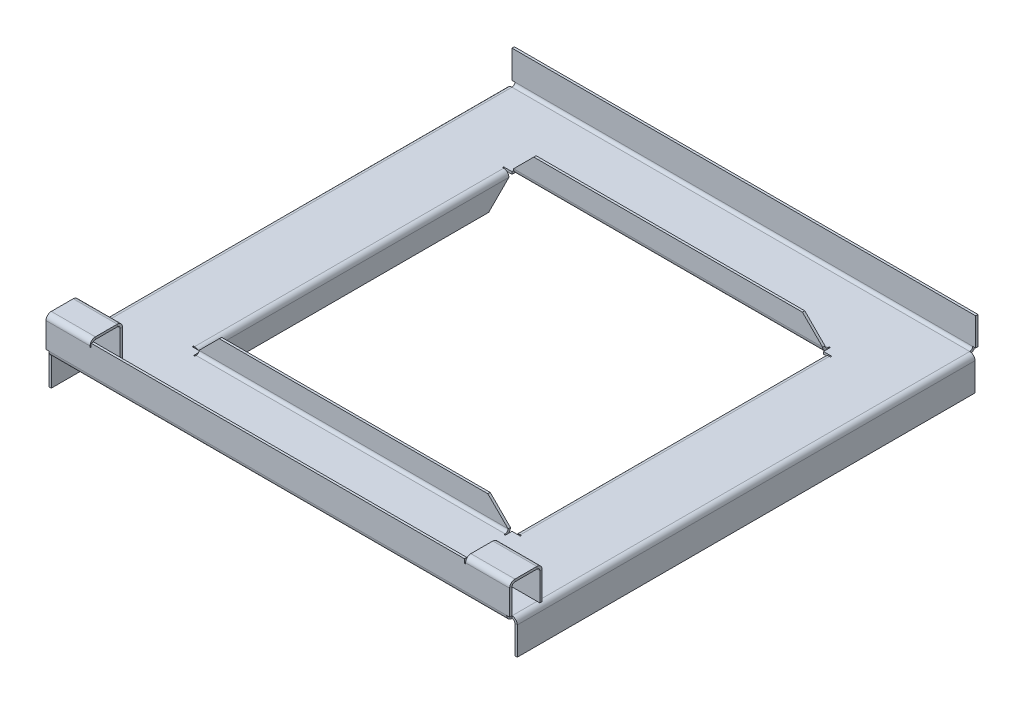
from build123d import *

# Parameters (mm, degrees)
SKETCH1_W                       = 300
SKETCH1_H                       = 300
SKETCH1_W_2                     = 200
SKETCH1_H_2                     = 200
BASE_FLANGE1_DEPTH              = 1.51892
EDGE_FLANGE10_STRIP_W           = 9.88568
EDGE_FLANGE10_STRIP_H           = 1.51892
EDGE_FLANGE10_STRIP_CUT_DEPTH   = 300
EDGE_FLANGE10_STRIP_2_W         = 9.88568
EDGE_FLANGE10_STRIP_2_H         = 1.51892
EDGE_FLANGE10_STRIP_CUT_2_DEPTH = 300
EDGE_FLANGE10_DEPTH             = 300
EDGE_FLANGE10_BEND_DEPTH        = 300
EDGE_FLANGE2_START              = -151.51892
EDGE_FLANGE2_DEPTH              = 303.03784
EDGE_FLANGE2_2_DEPTH            = 3.42392
EDGE_FLANGE2_START_2            = 148.095
EDGE_FLANGE2_3_DEPTH            = 3.42392
EDGE_FLANGE2_START_3            = -148.095
EDGE_FLANGE2_4_DEPTH            = 296.19
EDGE_FLANGE7_START              = -100.75946
EDGE_FLANGE7_DEPTH              = 201.51892
EDGE_FLANGE7_2_DEPTH            = 0.75946
EDGE_FLANGE7_START_2            = 100
EDGE_FLANGE7_3_DEPTH            = 0.75946
EDGE_FLANGE7_START_3            = -100
EDGE_FLANGE7_4_DEPTH            = 200
EDGE_FLANGE8_STRIP_W            = 11.88568
EDGE_FLANGE8_STRIP_H            = 1.51892
EDGE_FLANGE8_STRIP_CUT_DEPTH    = 200
EDGE_FLANGE8_RELIEF_W           = 12.64514
EDGE_FLANGE8_RELIEF_H           = 0.75946
EDGE_FLANGE8_RELIEF_CUT_DEPTH   = 1.51892
EDGE_FLANGE8_STRIP_2_W          = 11.88568
EDGE_FLANGE8_STRIP_2_H          = 1.51892
EDGE_FLANGE8_STRIP_CUT_2_DEPTH  = 200
EDGE_FLANGE8_RELIEF_2_W         = 12.64514
EDGE_FLANGE8_RELIEF_2_H         = 0.75946
EDGE_FLANGE8_RELIEF_CUT_2_DEPTH = 1.51892
EDGE_FLANGE8_DEPTH              = 200
EDGE_FLANGE8_BEND_DEPTH         = 200
BREAK_CORNER1_START             = -82.391318469
BREAK_CORNER1_OUTLINE_W         = 22
BREAK_CORNER1_OUTLINE_H         = 208
BREAK_CORNER1_DEPTH             = 9.258856193
BREAK_CORNER1_START_2           = 73.132462276
BREAK_CORNER1_2_OUTLINE_W       = 22
BREAK_CORNER1_2_OUTLINE_H       = 208
BREAK_CORNER1_2_DEPTH           = 9.258856193
BREAK_CORNER1_START_3           = -81.317279836
BREAK_CORNER1_3_OUTLINE_W       = 210
BREAK_CORNER1_3_OUTLINE_H       = 22
BREAK_CORNER1_3_DEPTH           = 9.258856192
BREAK_CORNER1_4_OUTLINE_W       = 210
BREAK_CORNER1_4_OUTLINE_H       = 22
BREAK_CORNER1_4_DEPTH           = 9.258856192
EDGE_FLANGE11_STRIP_W           = 9.88568
EDGE_FLANGE11_STRIP_H           = 1.51892
EDGE_FLANGE11_STRIP_CUT_DEPTH   = 28.504683669
EDGE_FLANGE11_RELIEF_W          = 10.64514
EDGE_FLANGE11_RELIEF_H          = 0.75946
EDGE_FLANGE11_RELIEF_CUT_DEPTH  = 1.51892
EDGE_FLANGE11_DEPTH             = 28.504683669
EDGE_FLANGE12_STRIP_W           = 9.88568
EDGE_FLANGE12_STRIP_H           = 1.51892
EDGE_FLANGE12_STRIP_CUT_DEPTH   = 28.504683669
EDGE_FLANGE12_DEPTH             = 28.504683669


# Read off the part's stored shape, not the designer's step: Edge-Flange2, Edge-Flange7, Break-Corner1
# Sheet-metal steps are written as plain solids
with BuildPart() as part:
    # Sketch1 → Base-Flange1 (new body)
    with BuildSketch(Plane(origin=(0, 0, 0), x_dir=(1, 0, 0), z_dir=(0, 1, 0))):
        Rectangle(SKETCH1_W, SKETCH1_H)
        Rectangle(SKETCH1_W_2, SKETCH1_H_2, mode=Mode.SUBTRACT)
    extrude(amount=BASE_FLANGE1_DEPTH)

    # Edge-Flange10 strip (across the edge) → Edge-Flange10 strip cut (cut)
    with BuildSketch(Plane(origin=(150, 1.51892, -150), x_dir=(0, 0, 1), z_dir=(-1, 0, 0))):
        with Locations((-3.03784, -0.75946)):
            Rectangle(EDGE_FLANGE10_STRIP_W, EDGE_FLANGE10_STRIP_H)
    extrude(amount=EDGE_FLANGE10_STRIP_CUT_DEPTH, mode=Mode.SUBTRACT)

    # Edge-Flange10 strip 2 (across the edge) → Edge-Flange10 strip cut 2 (cut)
    with BuildSketch(Plane(origin=(-150, 1.51892, 150), x_dir=(0, 0, -1), z_dir=(1, 0, 0))):
        with Locations((-3.03784, -0.75946)):
            Rectangle(EDGE_FLANGE10_STRIP_2_W, EDGE_FLANGE10_STRIP_2_H)
    extrude(amount=EDGE_FLANGE10_STRIP_CUT_2_DEPTH, mode=Mode.SUBTRACT)

    # Edge-Flange10 section (across the edge) → Edge-Flange10 (add)
    with BuildSketch(Plane(origin=(150, 1.51892, -150), x_dir=(0, 0, 1), z_dir=(-1, 0, 0))):
        with BuildLine():
            Line((-1.51892, 1.905), (-1.51892, 20))
            Line((-1.51892, 20), (0, 20))
            Line((0, 20), (0, 1.905))
            ThreePointArc((0, 1.905), (0.557961582, 0.557961582), (1.905, 0))
            Line((1.905, 0), (1.905, -1.51892))
            ThreePointArc((1.905, -1.51892), (-0.51607705, -0.51607705), (-1.51892, 1.905))
        make_face()
    extrude(amount=EDGE_FLANGE10_DEPTH)

    # Edge-Flange10 section 2 (across the edge) → Edge-Flange10 bend (add)
    with BuildSketch(Plane(origin=(-150, 1.51892, 150), x_dir=(0, 0, -1), z_dir=(1, 0, 0))):
        with BuildLine():
            Line((-1.51892, 1.905), (-1.51892, 20))
            Line((-1.51892, 20), (0, 20))
            Line((0, 20), (0, 1.905))
            ThreePointArc((0, 1.905), (0.557961582, 0.557961582), (1.905, 0))
            Line((1.905, 0), (1.905, -1.51892))
            ThreePointArc((1.905, -1.51892), (-0.51607705, -0.51607705), (-1.51892, 1.905))
        make_face()
    extrude(amount=EDGE_FLANGE10_BEND_DEPTH)

    # Edge-Flange2 outline → Edge-Flange2 (cut)
    with BuildSketch(Plane.XY.offset(EDGE_FLANGE2_START)):
        with BuildLine():
            Line((-148.095, 1.51892), (-148.095, 3.42392))
            Line((-148.095, 3.42392), (-150, 3.42392))
            Line((-150, 3.42392), (-150, 0.940031312))
            ThreePointArc((-150, 0.940031312), (-149.090507046, 1.37100273), (-148.095, 1.51892))
        make_face()
        with BuildLine():
            Line((150, 0.940031312), (150, 3.42392))
            Line((150, 3.42392), (148.095, 3.42392))
            Line((148.095, 3.42392), (148.095, 1.51892))
            ThreePointArc((148.095, 1.51892), (149.090507046, 1.37100273), (150, 0.940031312))
        make_face()
    extrude(amount=EDGE_FLANGE2_DEPTH, mode=Mode.SUBTRACT)

    # Edge-Flange2 2 outline → Edge-Flange2 2 (cut)
    with BuildSketch(Plane.XY.offset(EDGE_FLANGE2_START)):
        with BuildLine():
            Line((-148.095, 0), (-148.095, 1.51892))
            ThreePointArc((-148.095, 1.51892), (-149.090507046, 1.37100273), (-150, 0.940031312))
            ThreePointArc((-150, 0.940031312), (-151.115413528, -0.292446037), (-151.51892, -1.905))
            Line((-151.51892, -1.905), (-151.51892, -20))
            Line((-151.51892, -20), (-150, -20))
            Line((-150, -20), (-150, -1.905))
            ThreePointArc((-150, -1.905), (-149.442038418, -0.557961582), (-148.095, 0))
        make_face()
        with BuildLine():
            ThreePointArc((150, 0.940031312), (149.090507046, 1.37100273), (148.095, 1.51892))
            Line((148.095, 1.51892), (148.095, 0))
            ThreePointArc((148.095, 0), (149.442038418, -0.557961582), (150, -1.905))
            Line((150, -1.905), (150, -20))
            Line((150, -20), (151.51892, -20))
            Line((151.51892, -20), (151.51892, -1.905))
            ThreePointArc((151.51892, -1.905), (151.115413528, -0.292446037), (150, 0.940031312))
        make_face()
    extrude(amount=EDGE_FLANGE2_2_DEPTH, mode=Mode.SUBTRACT)

    # Edge-Flange2 3 outline → Edge-Flange2 3 (cut)
    with BuildSketch(Plane.XY.offset(EDGE_FLANGE2_START_2)):
        with BuildLine():
            Line((-148.095, 0), (-148.095, 1.51892))
            ThreePointArc((-148.095, 1.51892), (-149.090507046, 1.37100273), (-150, 0.940031312))
            ThreePointArc((-150, 0.940031312), (-151.115413528, -0.292446037), (-151.51892, -1.905))
            Line((-151.51892, -1.905), (-151.51892, -20))
            Line((-151.51892, -20), (-150, -20))
            Line((-150, -20), (-150, -1.905))
            ThreePointArc((-150, -1.905), (-149.442038418, -0.557961582), (-148.095, 0))
        make_face()
        with BuildLine():
            ThreePointArc((150, 0.940031312), (149.090507046, 1.37100273), (148.095, 1.51892))
            Line((148.095, 1.51892), (148.095, 0))
            ThreePointArc((148.095, 0), (149.442038418, -0.557961582), (150, -1.905))
            Line((150, -1.905), (150, -20))
            Line((150, -20), (151.51892, -20))
            Line((151.51892, -20), (151.51892, -1.905))
            ThreePointArc((151.51892, -1.905), (151.115413528, -0.292446037), (150, 0.940031312))
        make_face()
    extrude(amount=EDGE_FLANGE2_3_DEPTH, mode=Mode.SUBTRACT)

    # Edge-Flange2 4 outline → Edge-Flange2 4 (add)
    with BuildSketch(Plane.XY.offset(EDGE_FLANGE2_START_3)):
        with BuildLine():
            Line((-148.095, 0), (-148.095, 1.51892))
            ThreePointArc((-148.095, 1.51892), (-149.090507046, 1.37100273), (-150, 0.940031312))
            ThreePointArc((-150, 0.940031312), (-151.115413528, -0.292446037), (-151.51892, -1.905))
            Line((-151.51892, -1.905), (-151.51892, -20))
            Line((-151.51892, -20), (-150, -20))
            Line((-150, -20), (-150, -1.905))
            ThreePointArc((-150, -1.905), (-149.442038418, -0.557961582), (-148.095, 0))
        make_face()
        with BuildLine():
            ThreePointArc((150, 0.940031312), (149.090507046, 1.37100273), (148.095, 1.51892))
            Line((148.095, 1.51892), (148.095, 0))
            ThreePointArc((148.095, 0), (149.442038418, -0.557961582), (150, -1.905))
            Line((150, -1.905), (150, -20))
            Line((150, -20), (151.51892, -20))
            Line((151.51892, -20), (151.51892, -1.905))
            ThreePointArc((151.51892, -1.905), (151.115413528, -0.292446037), (150, 0.940031312))
        make_face()
    extrude(amount=EDGE_FLANGE2_4_DEPTH)

    # Edge-Flange7 outline → Edge-Flange7 (cut)
    with BuildSketch(Plane.YZ.offset(EDGE_FLANGE7_START)):
        with BuildLine():
            ThreePointArc((1.51892, 101.578888688), (0.403506472, 102.811366037), (0, 104.42392))
            Line((0, 104.42392), (0, 100))
            Line((0, 100), (1.51892, 100))
            Line((1.51892, 100), (1.51892, 101.578888688))
        make_face()
        with BuildLine():
            Line((1.51892, -100), (0, -100))
            Line((0, -100), (0, -104.42392))
            ThreePointArc((0, -104.42392), (0.403506472, -102.811366037), (1.51892, -101.578888688))
            Line((1.51892, -101.578888688), (1.51892, -100))
        make_face()
    extrude(amount=EDGE_FLANGE7_DEPTH, mode=Mode.SUBTRACT)

    # Edge-Flange7 2 outline → Edge-Flange7 2 (cut)
    with BuildSketch(Plane.YZ.offset(EDGE_FLANGE7_START)):
        with BuildLine():
            Line((1.51892, 105.18338), (0, 105.18338))
            Line((0, 105.18338), (0, 104.42392))
            ThreePointArc((0, 104.42392), (0.403506472, 102.811366037), (1.51892, 101.578888688))
            Line((1.51892, 101.578888688), (1.51892, 105.18338))
        make_face()
        with BuildLine():
            ThreePointArc((1.51892, -101.578888688), (0.403506472, -102.811366037), (0, -104.42392))
            Line((0, -104.42392), (0, -105.18338))
            Line((0, -105.18338), (1.51892, -105.18338))
            Line((1.51892, -105.18338), (1.51892, -101.578888688))
        make_face()
    extrude(amount=EDGE_FLANGE7_2_DEPTH, mode=Mode.SUBTRACT)

    # Edge-Flange7 3 outline → Edge-Flange7 3 (cut)
    with BuildSketch(Plane.YZ.offset(EDGE_FLANGE7_START_2)):
        with BuildLine():
            Line((1.51892, 105.18338), (0, 105.18338))
            Line((0, 105.18338), (0, 104.42392))
            ThreePointArc((0, 104.42392), (0.403506472, 102.811366037), (1.51892, 101.578888688))
            Line((1.51892, 101.578888688), (1.51892, 105.18338))
        make_face()
        with BuildLine():
            ThreePointArc((1.51892, -101.578888688), (0.403506472, -102.811366037), (0, -104.42392))
            Line((0, -104.42392), (0, -105.18338))
            Line((0, -105.18338), (1.51892, -105.18338))
            Line((1.51892, -105.18338), (1.51892, -101.578888688))
        make_face()
    extrude(amount=EDGE_FLANGE7_3_DEPTH, mode=Mode.SUBTRACT)

    # Edge-Flange7 4 outline → Edge-Flange7 4 (add)
    with BuildSketch(Plane.YZ.offset(EDGE_FLANGE7_START_3)):
        with BuildLine():
            ThreePointArc((3.42392, 102.51892), (2.076881582, 103.076881582), (1.51892, 104.42392))
            Line((1.51892, 104.42392), (1.51892, 101.578888688))
            ThreePointArc((1.51892, 101.578888688), (2.428412954, 101.14791727), (3.42392, 101))
            Line((3.42392, 101), (16.51892, 101))
            Line((16.51892, 101), (16.51892, 102.51892))
            Line((16.51892, 102.51892), (3.42392, 102.51892))
        make_face()
        with BuildLine():
            ThreePointArc((3.42392, -101), (2.428412954, -101.14791727), (1.51892, -101.578888688))
            Line((1.51892, -101.578888688), (1.51892, -104.42392))
            ThreePointArc((1.51892, -104.42392), (2.076881582, -103.076881582), (3.42392, -102.51892))
            Line((3.42392, -102.51892), (16.51892, -102.51892))
            Line((16.51892, -102.51892), (16.51892, -101))
            Line((16.51892, -101), (3.42392, -101))
        make_face()
    extrude(amount=EDGE_FLANGE7_4_DEPTH)

    # Edge-Flange8 strip (across the edge) → Edge-Flange8 strip cut (cut)
    with BuildSketch(Plane(origin=(102, 0, 100), x_dir=(1, 0, 0), z_dir=(0, 0, -1))):
        with Locations((-2.51892, -0.75946)):
            Rectangle(EDGE_FLANGE8_STRIP_W, EDGE_FLANGE8_STRIP_H)
    extrude(amount=EDGE_FLANGE8_STRIP_CUT_DEPTH, mode=Mode.SUBTRACT)

    # Edge-Flange8 relief (on the sheet) → Edge-Flange8 relief cut (cut)
    with BuildSketch(Plane(origin=(105.42392, 0, 100), x_dir=(1, 0, 0), z_dir=(0, -1, 0))):
        with Locations((-5.56311, 0.37973)):
            Rectangle(EDGE_FLANGE8_RELIEF_W, EDGE_FLANGE8_RELIEF_H)
        with Locations((-5.56311, -200.37973)):
            Rectangle(EDGE_FLANGE8_RELIEF_W, EDGE_FLANGE8_RELIEF_H)
    extrude(amount=-EDGE_FLANGE8_RELIEF_CUT_DEPTH, mode=Mode.SUBTRACT)

    # Edge-Flange8 strip 2 (across the edge) → Edge-Flange8 strip cut 2 (cut)
    with BuildSketch(Plane(origin=(-102, 0, -100), x_dir=(-1, 0, 0), z_dir=(0, 0, 1))):
        with Locations((-2.51892, -0.75946)):
            Rectangle(EDGE_FLANGE8_STRIP_2_W, EDGE_FLANGE8_STRIP_2_H)
    extrude(amount=EDGE_FLANGE8_STRIP_CUT_2_DEPTH, mode=Mode.SUBTRACT)

    # Edge-Flange8 relief 2 (on the sheet) → Edge-Flange8 relief cut 2 (cut)
    with BuildSketch(Plane(origin=(-105.42392, 0, -100), x_dir=(-1, 0, 0), z_dir=(0, -1, 0))):
        with Locations((-5.56311, 0.37973)):
            Rectangle(EDGE_FLANGE8_RELIEF_2_W, EDGE_FLANGE8_RELIEF_2_H)
        with Locations((-5.56311, -200.37973)):
            Rectangle(EDGE_FLANGE8_RELIEF_2_W, EDGE_FLANGE8_RELIEF_2_H)
    extrude(amount=-EDGE_FLANGE8_RELIEF_CUT_2_DEPTH, mode=Mode.SUBTRACT)

    # Edge-Flange8 section (across the edge) → Edge-Flange8 (add)
    with BuildSketch(Plane(origin=(102, 0, 100), x_dir=(1, 0, 0), z_dir=(0, 0, -1))):
        with BuildLine():
            Line((0, 1.905), (0, 15))
            Line((0, 15), (1.51892, 15))
            Line((1.51892, 15), (1.51892, 1.905))
            ThreePointArc((1.51892, 1.905), (2.076881582, 0.557961582), (3.42392, 0))
            Line((3.42392, 0), (3.42392, -1.51892))
            ThreePointArc((3.42392, -1.51892), (1.00284295, -0.51607705), (0, 1.905))
        make_face()
    extrude(amount=EDGE_FLANGE8_DEPTH)

    # Edge-Flange8 section 2 (across the edge) → Edge-Flange8 bend (add)
    with BuildSketch(Plane(origin=(-102, 0, -100), x_dir=(-1, 0, 0), z_dir=(0, 0, 1))):
        with BuildLine():
            Line((0, 1.905), (0, 15))
            Line((0, 15), (1.51892, 15))
            Line((1.51892, 15), (1.51892, 1.905))
            ThreePointArc((1.51892, 1.905), (2.076881582, 0.557961582), (3.42392, 0))
            Line((3.42392, 0), (3.42392, -1.51892))
            ThreePointArc((3.42392, -1.51892), (1.00284295, -0.51607705), (0, 1.905))
        make_face()
    extrude(amount=EDGE_FLANGE8_BEND_DEPTH)

    # Break-Corner1 outline → Break-Corner1 (cut)
    with BuildSketch(Plane(origin=(0, 0, 0), x_dir=(0.7071067811865471, 0.707106781186548, 0), z_dir=(0.707106781186548, -0.707106781186547, 0)).offset(BREAK_CORNER1_START)):
        with Locations((-59, 0)):
            Rectangle(BREAK_CORNER1_OUTLINE_W, BREAK_CORNER1_OUTLINE_H)
    extrude(amount=BREAK_CORNER1_DEPTH, mode=Mode.SUBTRACT)

    # Break-Corner1 2 outline → Break-Corner1 2 (cut)
    with BuildSketch(Plane(origin=(0, 0, 0), x_dir=(0.7071067811865471, -0.707106781186548, 0), z_dir=(0.707106781186548, 0.707106781186547, 0)).offset(BREAK_CORNER1_START_2)):
        with Locations((59, 0)):
            Rectangle(BREAK_CORNER1_2_OUTLINE_W, BREAK_CORNER1_2_OUTLINE_H)
    extrude(amount=BREAK_CORNER1_2_DEPTH, mode=Mode.SUBTRACT)

    # Break-Corner1 3 outline → Break-Corner1 3 (cut)
    with BuildSketch(Plane(origin=(0, 0, 0), x_dir=(1, 0, 0), z_dir=(0, 0.707106781186549, -0.707106781186546)).offset(BREAK_CORNER1_START_3)):
        with Locations((0, -60)):
            Rectangle(BREAK_CORNER1_3_OUTLINE_W, BREAK_CORNER1_3_OUTLINE_H)
    extrude(amount=BREAK_CORNER1_3_DEPTH, mode=Mode.SUBTRACT)

    # Break-Corner1 4 outline → Break-Corner1 4 (cut)
    with BuildSketch(Plane(origin=(0, 0, 0), x_dir=(1, 0, 0), z_dir=(0, 0.707106781186547, 0.707106781186548)).offset(BREAK_CORNER1_START_3)):
        with Locations((0, 60)):
            Rectangle(BREAK_CORNER1_4_OUTLINE_W, BREAK_CORNER1_4_OUTLINE_H)
    extrude(amount=BREAK_CORNER1_4_DEPTH, mode=Mode.SUBTRACT)

    # Edge-Flange11 strip (across the edge) → Edge-Flange11 strip cut (cut)
    with BuildSketch(Plane(origin=(-150, 21.51892, 150), x_dir=(0, -1, 0), z_dir=(1, 0, 0))):
        with Locations((-3.03784, -0.75946)):
            Rectangle(EDGE_FLANGE11_STRIP_W, EDGE_FLANGE11_STRIP_H)
    edge_flange11_strip_cut = extrude(amount=EDGE_FLANGE11_STRIP_CUT_DEPTH, mode=Mode.SUBTRACT)

    # Edge-Flange11 relief (on the sheet) → Edge-Flange11 relief cut (cut)
    with BuildSketch(Plane(origin=(-150, 19.61392, 150), x_dir=(0, -1, 0), z_dir=(0, 0, -1))):
        with Locations((-4.56311, -28.884413669)):
            Rectangle(EDGE_FLANGE11_RELIEF_W, EDGE_FLANGE11_RELIEF_H)
    edge_flange11_relief_cut = extrude(amount=-EDGE_FLANGE11_RELIEF_CUT_DEPTH, mode=Mode.SUBTRACT)

    # Edge-Flange11 section (across the edge) → Edge-Flange11 (add)
    with BuildSketch(Plane(origin=(-150, 21.51892, 150), x_dir=(0, -1, 0), z_dir=(1, 0, 0))):
        with BuildLine():
            Line((-1.51892, 1.905), (-1.51892, 18))
            Line((-1.51892, 18), (0, 18))
            Line((0, 18), (0, 1.905))
            ThreePointArc((0, 1.905), (0.557961582, 0.557961582), (1.905, 0))
            Line((1.905, 0), (1.905, -1.51892))
            ThreePointArc((1.905, -1.51892), (-0.51607705, -0.51607705), (-1.51892, 1.905))
        make_face()
    edge_flange11 = extrude(amount=EDGE_FLANGE11_DEPTH)

    # Edge-Flange12 strip (across the edge) → Edge-Flange12 strip cut (cut)
    with BuildSketch(Plane(origin=(-150, 21.51892, 132), x_dir=(0, 0, 1), z_dir=(1, 0, 0))):
        with Locations((-3.03784, -0.75946)):
            Rectangle(EDGE_FLANGE12_STRIP_W, EDGE_FLANGE12_STRIP_H)
    edge_flange12_strip_cut = extrude(amount=EDGE_FLANGE12_STRIP_CUT_DEPTH, mode=Mode.SUBTRACT)

    # Edge-Flange12 section (across the edge) → Edge-Flange12 (add)
    with BuildSketch(Plane(origin=(-150, 21.51892, 132), x_dir=(0, 0, 1), z_dir=(1, 0, 0))):
        with BuildLine():
            Line((-1.51892, 1.905), (-1.51892, 19.9))
            Line((-1.51892, 19.9), (0, 19.9))
            Line((0, 19.9), (0, 1.905))
            ThreePointArc((0, 1.905), (0.557961582, 0.557961582), (1.905, 0))
            Line((1.905, 0), (1.905, -1.51892))
            ThreePointArc((1.905, -1.51892), (-0.51607705, -0.51607705), (-1.51892, 1.905))
        make_face()
    edge_flange12 = extrude(amount=EDGE_FLANGE12_DEPTH)

    # Mirror1: Edge-Flange11 strip cut, Edge-Flange11 relief cut, Edge-Flange11, Edge-Flange12 strip cut, Edge-Flange12 across plane
    add(edge_flange11_strip_cut.mirror(Plane(origin=(0, 0, 0), x_dir=(0, 0, 1), z_dir=(1, 0, 0))), mode=Mode.SUBTRACT)
    add(edge_flange11_relief_cut.mirror(Plane(origin=(0, 0, 0), x_dir=(0, 0, 1), z_dir=(1, 0, 0))), mode=Mode.SUBTRACT)
    add(edge_flange11.mirror(Plane(origin=(0, 0, 0), x_dir=(0, 0, 1), z_dir=(1, 0, 0))))
    add(edge_flange12_strip_cut.mirror(Plane(origin=(0, 0, 0), x_dir=(0, 0, 1), z_dir=(1, 0, 0))), mode=Mode.SUBTRACT)
    add(edge_flange12.mirror(Plane(origin=(0, 0, 0), x_dir=(0, 0, 1), z_dir=(1, 0, 0))))


solid = part.part
